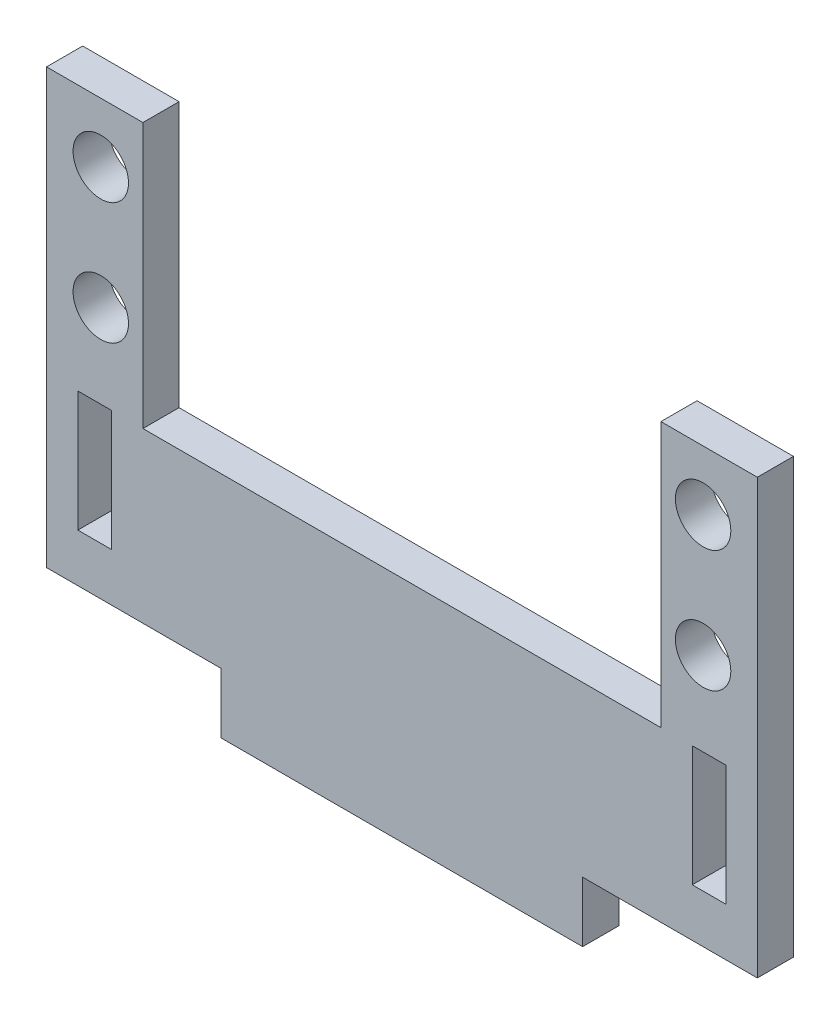
from build123d import *

# Parameters (mm, degrees)
SKETCH1_R           = 2.3
BOSS_EXTRUDE1_DEPTH = 3
SKETCH3_W           = 2.8
SKETCH3_H           = 10
CUT_EXTRUDE1_DEPTH  = 10
SKETCH4_W           = 30
SKETCH4_H           = 3
BOSS_EXTRUDE2_DEPTH = 5


with BuildPart() as part:
    # Sketch1 → Boss-Extrude1 (new body)
    with BuildSketch(Plane.XY):
        Polygon((8, 0), (0, 0), (0, -36), (59, -36), (59, 0), (51, 0), (51, -22), (8, -22), align=None)
        with Locations((4.5, -15.05)):
            Circle(SKETCH1_R, mode=Mode.SUBTRACT)
        with Locations((4.5, -4.95)):
            Circle(SKETCH1_R, mode=Mode.SUBTRACT)
        with Locations((54.5, -15.05)):
            Circle(SKETCH1_R, mode=Mode.SUBTRACT)
        with Locations((54.5, -4.95)):
            Circle(SKETCH1_R, mode=Mode.SUBTRACT)
    extrude(amount=BOSS_EXTRUDE1_DEPTH)

    # Sketch3 → Cut-Extrude1 (cut)
    with BuildSketch(Plane.XY.offset(3)):
        with Locations((4, -27)):
            Rectangle(SKETCH3_W, SKETCH3_H)
        with Locations((55, -27)):
            Rectangle(SKETCH3_W, SKETCH3_H)
    extrude(amount=-CUT_EXTRUDE1_DEPTH, mode=Mode.SUBTRACT)

    # Sketch4 → Boss-Extrude2 (add)
    with BuildSketch(Plane.XZ.offset(36)):
        with Locations((29.5, 1.5)):
            Rectangle(SKETCH4_W, SKETCH4_H)
    extrude(amount=BOSS_EXTRUDE2_DEPTH)


solid = part.part
